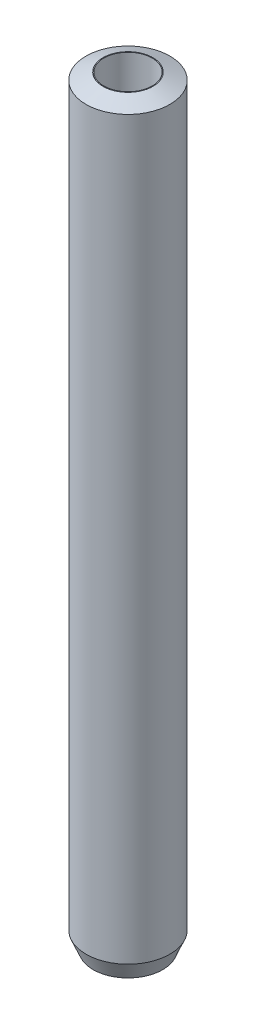
from build123d import *
from OCP.BRepFilletAPI import BRepFilletAPI_MakeChamfer

# Parameters (mm, degrees)
SKETCH1_R           = 30
BOSS_EXTRUDE1_DEPTH = 543.977092285
SKETCH2_R           = 17.315516523
CUT_EXTRUDE1_DEPTH  = 546.629065328
CHAMFER1_SIZE       = 5.084709081
CHAMFER1_SIZE2      = 12.140206785


with BuildPart() as part:
    # Sketch1 → Boss-Extrude1 (new body)
    with BuildSketch(Plane(origin=(0, 0, 0), x_dir=(1, 0, 0), z_dir=(0, 1, 0))):
        Circle(SKETCH1_R)
    extrude(amount=BOSS_EXTRUDE1_DEPTH)

    # Sketch2 → Cut-Extrude1 (cut, through all)
    with BuildSketch(Plane(origin=(0, 0, 0), x_dir=(1, 0, 0), z_dir=(0, 1, 0))):
        Circle(SKETCH2_R)
    extrude(amount=CUT_EXTRUDE1_DEPTH, mode=Mode.SUBTRACT)

    # Chamfer1: one chamfer whose edges measure the first distance from different faces: ONE call of the kernel's chamfer builder (chamfer() names one face for all edges)
    chamfer1_edges_1 = [part.edges().sort_by_distance(p)[0] for p in [
        (-30, 543.977092285, 0),
    ]]
    chamfer1_side_1 = [part.faces().sort_by_distance(p)[0] for p in [
        (-30, 271.988546143, 0),
    ]]
    chamfer1_edges_2 = [part.edges().sort_by_distance(p)[0] for p in [
        (-30, 0, 0),
    ]]
    chamfer1_side_2 = [part.faces().sort_by_distance(p)[0] for p in [
        (-29.151471863, 0, 0),
    ]]
    chamfer1 = BRepFilletAPI_MakeChamfer(part.part.solid().wrapped)
    for e in chamfer1_edges_1:
        chamfer1.Add(CHAMFER1_SIZE, CHAMFER1_SIZE2, e.wrapped, chamfer1_side_1[0].wrapped)  # the first distance lies on this face
    for e in chamfer1_edges_2:
        chamfer1.Add(CHAMFER1_SIZE, CHAMFER1_SIZE2, e.wrapped, chamfer1_side_2[0].wrapped)  # the first distance lies on this face
    add(Compound.cast(chamfer1.Shape()), mode=Mode.REPLACE)


solid = part.part
